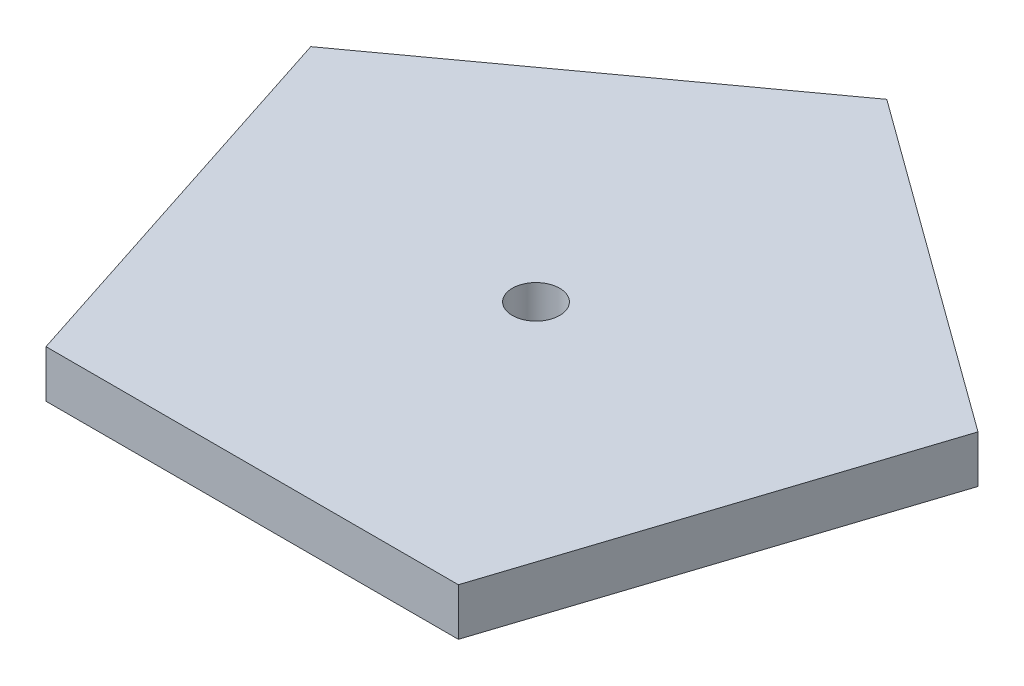
from build123d import *

# Parameters (mm, degrees)
BOSS_EXTRUDE1_DEPTH = 6.35
SKETCH2_R           = 3.175
CUT_EXTRUDE1_DEPTH  = 66.301308624


with BuildPart() as part:
    # Sketch1 → Boss-Extrude1 (new body)
    with BuildSketch(Plane(origin=(0, 0, 0), x_dir=(1, 0, 0), z_dir=(0, 1, 0))):
        Polygon((-44.789236225, 14.552905029), (-27.681270317, -38.1), (27.681270317, -38.1), (44.789236225, 14.552905029), (0, 47.094189943), align=None)
    extrude(amount=BOSS_EXTRUDE1_DEPTH)

    # Sketch2 → Cut-Extrude1 (cut, through all)
    with BuildSketch(Plane(origin=(0, 6.35, 0), x_dir=(1, 0, 0), z_dir=(0, 1, 0))):
        Circle(SKETCH2_R)
    extrude(amount=-CUT_EXTRUDE1_DEPTH, mode=Mode.SUBTRACT)


solid = part.part
